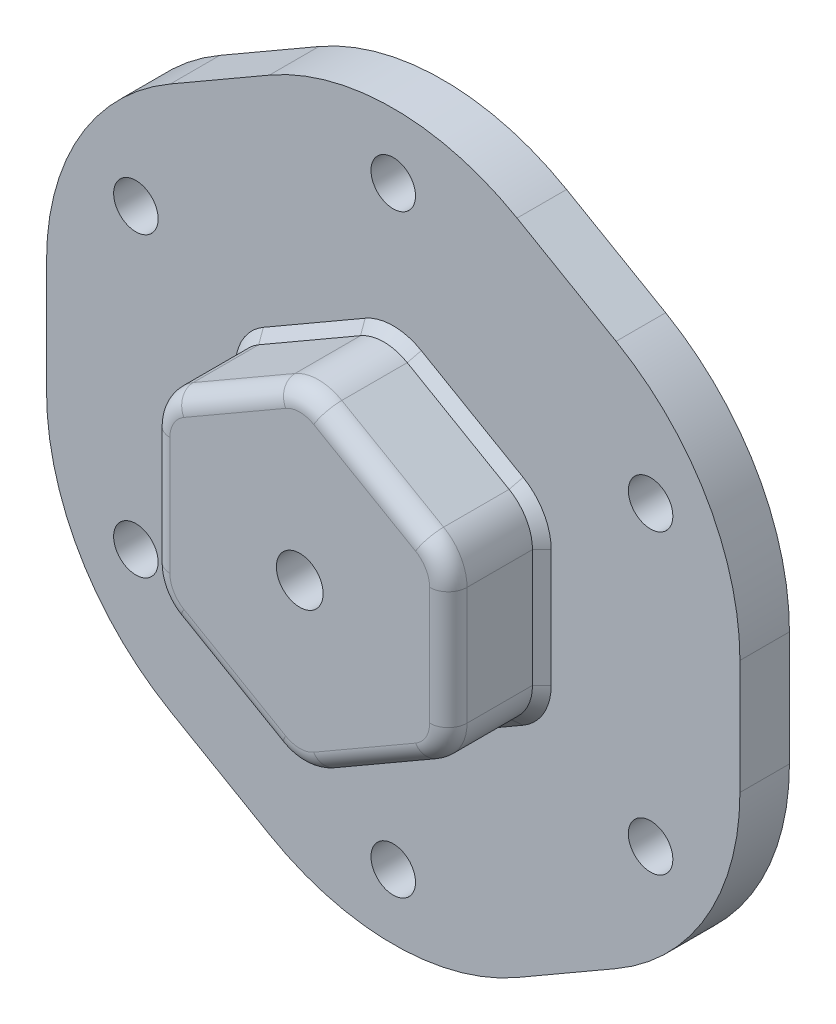
from build123d import *

# Parameters (mm, degrees)
SKETCH1_R             = 2.38125
BOSS_EXTRUDE1_DEPTH   = 5.298013245
SKETCH3_R             = 2.5
BOSS_EXTRUDE4_DEPTH   = 10
CHAMFER2_SIZE         = 1
FILLET1_R             = 2
CORTAR_EXTRUIR1_START = -10
CROQUIS1_R            = 2.5
CORTAR_EXTRUIR1_DEPTH = 10


with BuildPart() as part:
    # Sketch1 → Boss-Extrude1 (new body)
    with BuildSketch(Plane.XY):
        with BuildLine():
            Line((-13.245033113, 35.176307792), (-23.841059603, 29.058689045))
            ThreePointArc((-23.841059603, 29.058689045), (-33.537096789, 19.362651859), (-37.086092715, 6.117618746))
            Line((-37.086092715, 6.117618746), (-37.086092715, -6.117618746))
            ThreePointArc((-37.086092715, -6.117618746), (-33.537096789, -19.362651859), (-23.841059603, -29.058689045))
            Line((-23.841059603, -29.058689045), (-13.245033113, -35.176307792))
            ThreePointArc((-13.245033113, -35.176307792), (0, -38.725303718), (13.245033113, -35.176307792))
            Line((13.245033113, -35.176307792), (23.841059603, -29.058689045))
            ThreePointArc((23.841059603, -29.058689045), (33.537096789, -19.362651859), (37.086092715, -6.117618746))
            Line((37.086092715, -6.117618746), (37.086092715, 6.117618746))
            ThreePointArc((37.086092715, 6.117618746), (33.537096789, 19.362651859), (23.841059603, 29.058689045))
            Line((23.841059603, 29.058689045), (13.245033113, 35.176307792))
            ThreePointArc((13.245033113, 35.176307792), (0, 38.725303718), (-13.245033113, 35.176307792))
        make_face()
        with Locations((0, 31.78807947)):
            Circle(SKETCH1_R, mode=Mode.SUBTRACT)
        with Locations((27.529284359, 15.894039735)):
            Circle(SKETCH1_R, mode=Mode.SUBTRACT)
        with Locations((27.529284359, -15.894039735)):
            Circle(SKETCH1_R, mode=Mode.SUBTRACT)
        with Locations((0, -31.78807947)):
            Circle(SKETCH1_R, mode=Mode.SUBTRACT)
        with Locations((-27.529284359, -15.894039735)):
            Circle(SKETCH1_R, mode=Mode.SUBTRACT)
        with Locations((-27.529284359, 15.894039735)):
            Circle(SKETCH1_R, mode=Mode.SUBTRACT)
    extrude(amount=BOSS_EXTRUDE1_DEPTH)

    # Sketch3 → Boss-Extrude4 (add)
    with BuildSketch(Plane.XY.offset(5.298013245)):
        with BuildLine():
            Line((-2.5, 16.909480566), (-13.394039735, 10.619803793))
            ThreePointArc((-13.394039735, 10.619803793), (-15.224166754, 8.789676774), (-15.894039735, 6.289676774))
            Line((-15.894039735, 6.289676774), (-15.894039735, -6.289676774))
            ThreePointArc((-15.894039735, -6.289676774), (-15.224166754, -8.789676774), (-13.394039735, -10.619803793))
            Line((-13.394039735, -10.619803793), (-2.5, -16.909480566))
            ThreePointArc((-2.5, -16.909480566), (0, -17.579353547), (2.5, -16.909480566))
            Line((2.5, -16.909480566), (13.394039735, -10.619803793))
            ThreePointArc((13.394039735, -10.619803793), (15.224166754, -8.789676774), (15.894039735, -6.289676774))
            Line((15.894039735, -6.289676774), (15.894039735, 6.289676774))
            ThreePointArc((15.894039735, 6.289676774), (15.224166754, 8.789676774), (13.394039735, 10.619803793))
            Line((13.394039735, 10.619803793), (2.5, 16.909480566))
            ThreePointArc((2.5, 16.909480566), (0, 17.579353547), (-2.5, 16.909480566))
        make_face()
        Circle(SKETCH3_R, mode=Mode.SUBTRACT)
    extrude(amount=BOSS_EXTRUDE4_DEPTH)

    # Chamfer2
    chamfer2_edges = [part.edges().sort_by_distance(p)[0] for p in [
        (7.947019868, 13.764642179, 5.298013245),
        (15.894039735, 0, 5.298013245),
        (7.947019868, -13.764642179, 5.298013245),
        (-7.947019868, -13.764642179, 5.298013245),
        (-15.894039735, 0, 5.298013245),
        (-7.947019868, 13.764642179, 5.298013245),
        (15.224166754, -8.789676774, 5.298013245),
        (0, -17.579353547, 5.298013245),
        (15.224166754, 8.789676774, 5.298013245),
        (-15.224166754, -8.789676774, 5.298013245),
        (0, 17.579353547, 5.298013245),
        (-15.224166754, 8.789676774, 5.298013245),
    ]]
    chamfer(chamfer2_edges, length=CHAMFER2_SIZE)

    # Fillet1
    fillet1_edges = [part.edges().sort_by_distance(p)[0] for p in [
        (15.224166754, -8.789676774, 15.298013245),
        (7.947019868, -13.764642179, 15.298013245),
        (0, -17.579353547, 15.298013245),
        (-7.947019868, -13.764642179, 15.298013245),
        (-15.224166754, -8.789676774, 15.298013245),
        (-15.894039735, 0, 15.298013245),
        (-15.224166754, 8.789676774, 15.298013245),
        (-7.947019868, 13.764642179, 15.298013245),
        (0, 17.579353547, 15.298013245),
        (7.947019868, 13.764642179, 15.298013245),
        (15.224166754, 8.789676774, 15.298013245),
        (15.894039735, 0, 15.298013245),
    ]]
    fillet(fillet1_edges, radius=FILLET1_R)

    # Croquis1 → Cortar-Extruir1 (cut)
    with BuildSketch(Plane.XY.offset(5.298013245).offset(CORTAR_EXTRUIR1_START)):
        Circle(CROQUIS1_R)
    extrude(amount=CORTAR_EXTRUIR1_DEPTH, mode=Mode.SUBTRACT)


solid = part.part
